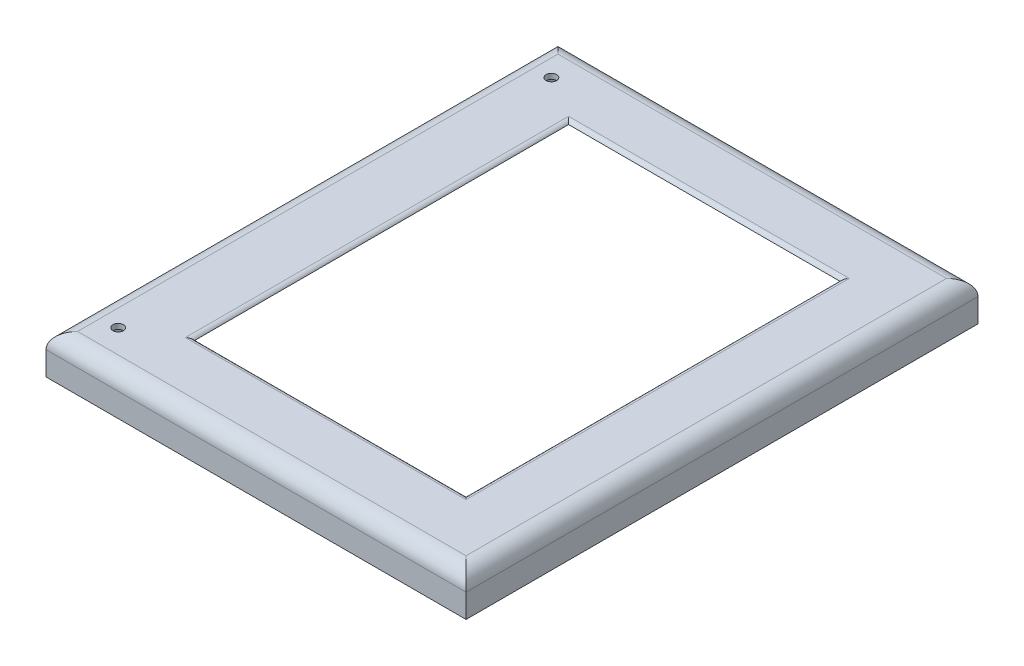
from build123d import *

# Parameters (mm, degrees)
SKETCH1_W           = 203.2
SKETCH1_H           = 247.65
BOSS_EXTRUDE1_DEPTH = 19.05
FILLET1_R           = 7.62
SHELL1_T            = -2.54
CUT_EXTRUDE1_REACH  = 163.301
SKETCH2_W           = 130.745
SKETCH2_H           = 180.34
FILLET2_R           = 2.54
CUT_EXTRUDE2_REACH  = 163.301
SKETCH3_R           = 2.54
SKETCH4_W           = 135.825
SKETCH4_H           = 185.42
CUT_EXTRUDE3_DEPTH  = 1.27


with BuildPart() as part:
    # Sketch1 → Boss-Extrude1 (new body)
    with BuildSketch(Plane(origin=(0, 0, 0), x_dir=(1, 0, 0), z_dir=(0, 1, 0))):
        Rectangle(SKETCH1_W, SKETCH1_H)
    extrude(amount=BOSS_EXTRUDE1_DEPTH)

    # Fillet1
    fillet1_edges = [part.edges().sort_by_distance(p)[0] for p in [
        (-101.6, 19.05, 0),
        (0, 19.05, 123.825),
        (101.6, 19.05, 0),
        (0, 19.05, -123.825),
    ]]
    fillet(fillet1_edges, radius=FILLET1_R)

    # Shell1
    shell1_openings = [part.faces().sort_by_distance(p)[0] for p in [
        (0, 0, 0),
    ]]
    offset(amount=SHELL1_T, openings=shell1_openings)

    # Sketch2 → Cut-Extrude1 (cut, up to next)
    with BuildSketch(Plane(origin=(0, 19.05, 0), x_dir=(1, 0, 0), z_dir=(0, 1, 0)), mode=Mode.PRIVATE) as cut_extrude1_sk1:
        with Locations((2.5725, 0)):
            Rectangle(SKETCH2_W, SKETCH2_H)
    cut_extrude1_tool1 = extrude(cut_extrude1_sk1.sketch, amount=-CUT_EXTRUDE1_REACH, mode=Mode.PRIVATE) & part.part
    add(cut_extrude1_tool1.solids().sort_by_distance((2.5725, 19.05, 0))[0], mode=Mode.SUBTRACT)

    # Fillet2
    fillet2_edges = [part.edges().sort_by_distance(p)[0] for p in [
        (-62.8, 19.05, 0),
        (2.5725, 19.05, 90.17),
        (67.945, 19.05, 0),
        (2.5725, 19.05, -90.17),
    ]]
    fillet(fillet2_edges, radius=FILLET2_R - 0.0001)  # a hair under: the kernel refuses the full size

    # Sketch3 → Cut-Extrude2 (cut, up to next)
    with BuildSketch(Plane(origin=(0, 19.05, 0), x_dir=(1, 0, 0), z_dir=(0, 1, 0)), mode=Mode.PRIVATE) as cut_extrude2_sk1:
        with Locations(Location((-85.725, 104.775, 0), (0, 0, 270))):
            Circle(SKETCH3_R)
    cut_extrude2_tool1 = extrude(cut_extrude2_sk1.sketch, amount=-CUT_EXTRUDE2_REACH, mode=Mode.PRIVATE) & part.part
    # Sketch3 → Cut-Extrude2 (cut, up to next)
    with BuildSketch(Plane(origin=(0, 19.05, 0), x_dir=(1, 0, 0), z_dir=(0, 1, 0)), mode=Mode.PRIVATE) as cut_extrude2_sk2:
        with Locations(Location((-85.725, -104.775, 0), (0, 0, 270))):
            Circle(SKETCH3_R)
    cut_extrude2_tool2 = extrude(cut_extrude2_sk2.sketch, amount=-CUT_EXTRUDE2_REACH, mode=Mode.PRIVATE) & part.part
    add(cut_extrude2_tool1.solids().sort_by_distance((-85.725, 19.05, -104.775))[0], mode=Mode.SUBTRACT)
    add(cut_extrude2_tool2.solids().sort_by_distance((-85.725, 19.05, 104.775))[0], mode=Mode.SUBTRACT)

    # Sketch4 → Cut-Extrude3 (cut)
    with BuildSketch(Plane.XZ.offset(-16.51)):
        with Locations((2.5725, 0)):
            Rectangle(SKETCH4_W, SKETCH4_H)
    extrude(amount=-CUT_EXTRUDE3_DEPTH, mode=Mode.SUBTRACT)


solid = part.part
